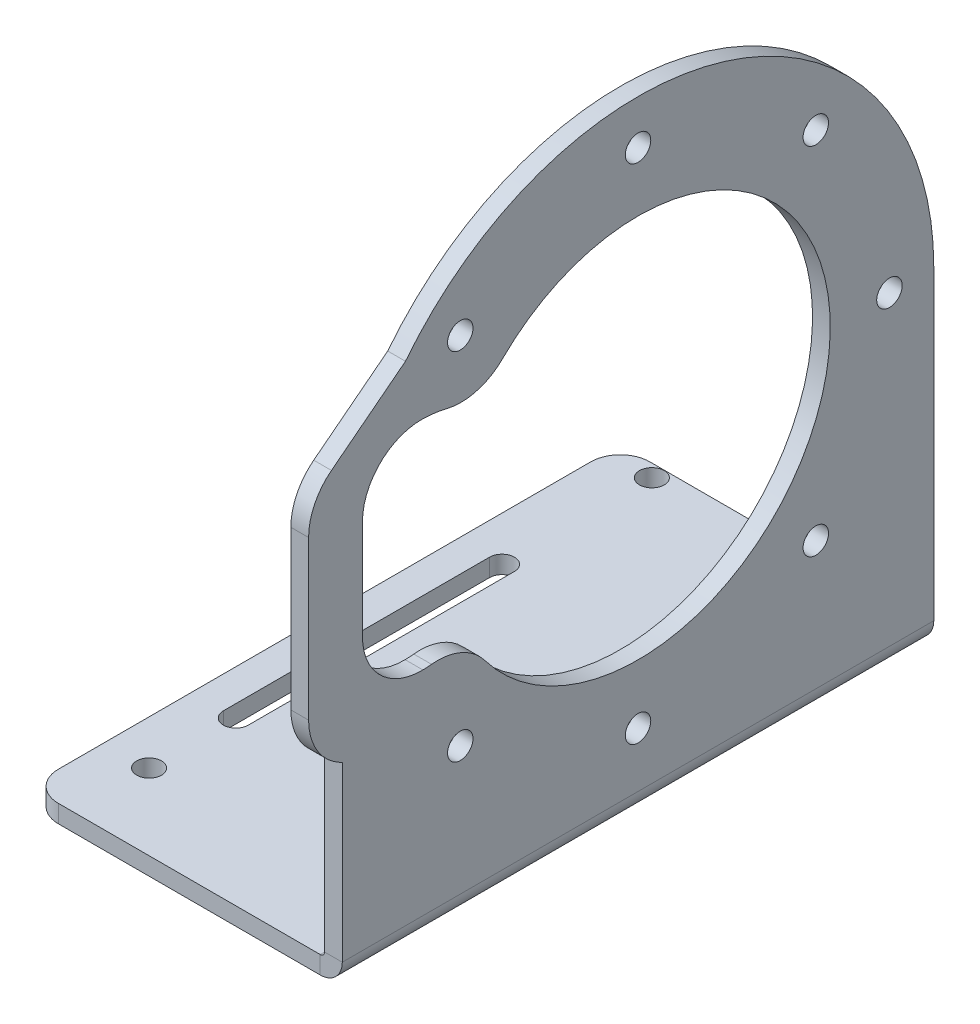
from build123d import *

# Parameters (mm, degrees)
SKETCH_1_R                       = 2.15
SM_BASE_FLANGE_1_DEPTH           = 3
SM_EDGE_FLANGE_1_STRIP_W         = 13.4732
SM_EDGE_FLANGE_1_STRIP_H         = 3
SM_EDGE_FLANGE_1_STRIP_CUT_DEPTH = 100
SM_EDGE_FLANGE_1_DEPTH           = 100
SKETCH_9_R                       = 2.1
CUT_EXTRUDE_1_DEPTH              = 10
FILLET_1_R                       = 5
SKETCH_10_R                      = 2.1
CUT_EXTRUDE_2_DEPTH              = 10


# Sheet-metal steps are written as plain solids
with BuildPart() as part:
    # Sketch 1 → 基体-法兰1 (new body)
    with BuildSketch(Plane(origin=(0, 0, 0), x_dir=(0, 0, -1), z_dir=(1, 0, 0))):
        with BuildLine():
            Line((-50, -22.510788707), (-50, -55.5))
            Line((-50, -55.5), (50, -55.5))
            Line((50, -55.5), (50, 0))
            ThreePointArc((50, 0), (16.339860062, 47.254724348), (-39.320358927, 30.885423324))
            Line((-39.320358927, 30.885423324), (-51.83191014, 21.160585638))
            ThreePointArc((-51.83191014, 21.160585638), (-54.677464079, 17.660055501), (-55.695008503, 13.265116159))
            Line((-55.695008503, 13.265116159), (-55.695008503, -13.471087591))
            ThreePointArc((-55.695008503, -13.471087591), (-54.312022765, -18.545244191), (-50.545595463, -22.215903549))
            ThreePointArc((-50.545595463, -22.215903549), (-50.273602999, -22.364836031), (-50, -22.510788707))
        make_face()
        with Locations((0, 42.5)):
            Circle(SKETCH_1_R, mode=Mode.SUBTRACT)
        with Locations((30.0520382, 30.0520382)):
            Circle(SKETCH_1_R, mode=Mode.SUBTRACT)
        with Locations((42.5, 0)):
            Circle(SKETCH_1_R, mode=Mode.SUBTRACT)
        with Locations((30.0520382, -30.0520382)):
            Circle(SKETCH_1_R, mode=Mode.SUBTRACT)
        with Locations((0, -42.5)):
            Circle(SKETCH_1_R, mode=Mode.SUBTRACT)
        with Locations((-30.0520382, -30.0520382)):
            Circle(SKETCH_1_R, mode=Mode.SUBTRACT)
        with Locations((-30.0520382, 30.0520382)):
            Circle(SKETCH_1_R, mode=Mode.SUBTRACT)
        with BuildLine():
            Line((-46.595603285, 10.997841176), (-46.595603285, -5.777394466))
            ThreePointArc((-46.595603285, -5.777394466), (-43.590659136, -12.923665777), (-36.381764555, -15.775107854))
            ThreePointArc((-36.381764555, -15.775107854), (-35.646197226, -15.744635296), (-34.912439019, -15.684745692))
            ThreePointArc((-34.912439019, -15.684745692), (-29.904748182, -16.465924493), (-25.923223086, -19.601951556))
            ThreePointArc((-25.923223086, -19.601951556), (32.418442092, -2.301002457), (-22.894661052, 23.066956784))
            ThreePointArc((-22.894661052, 23.066956784), (-27.279217704, 20.524739091), (-32.347042381, 20.45870218))
            ThreePointArc((-32.347042381, 20.45870218), (-34.349504558, 20.839101356), (-36.381764555, 20.995554565))
            ThreePointArc((-36.381764555, 20.995554565), (-43.590659136, 18.144112487), (-46.595603285, 10.997841176))
        make_face(mode=Mode.SUBTRACT)
    extrude(amount=-SM_BASE_FLANGE_1_DEPTH)

    # 边线-法兰1 strip (across the edge) → 边线-法兰1 strip cut (cut)
    with BuildSketch(Plane(origin=(-3, -55.5, -50), x_dir=(0, 1, 0), z_dir=(0, 0, 1))):
        with Locations((-3, -1.5)):
            Rectangle(SM_EDGE_FLANGE_1_STRIP_W, SM_EDGE_FLANGE_1_STRIP_H)
    extrude(amount=SM_EDGE_FLANGE_1_STRIP_CUT_DEPTH, mode=Mode.SUBTRACT)

    # 边线-法兰1 section (across the edge) → 边线-法兰1 (add)
    with BuildSketch(Plane(origin=(-3, -55.5, -50), x_dir=(0, 1, 0), z_dir=(0, 0, 1))):
        with BuildLine():
            Line((0, 0.7366), (0, 50))
            Line((0, 50), (3, 50))
            Line((3, 50), (3, 0.7366))
            ThreePointArc((3, 0.7366), (3.215745145, 0.215745145), (3.7366, 0))
            Line((3.7366, 0), (3.7366, -3))
            ThreePointArc((3.7366, -3), (1.094424801, -1.905575199), (0, 0.7366))
        make_face()
    extrude(amount=SM_EDGE_FLANGE_1_DEPTH)

    # 草图9 → 切除-拉伸1 (cut)
    with BuildSketch(Plane(origin=(0, -52.5, 0), x_dir=(1, 0, 0), z_dir=(0, 1, 0))):
        with Locations(Location((-45.5, 47.839820537, 0), (0, 0, 180))):
            Circle(SKETCH_9_R)
        with Locations(Location((-10.5, 47.839820537, 0), (0, 0, 180))):
            Circle(SKETCH_9_R)
        with Locations(Location((-45.5, -37.160179463, 0), (0, 0, 180))):
            Circle(SKETCH_9_R)
        with Locations(Location((-10.5, -37.160179463, 0), (0, 0, 180))):
            Circle(SKETCH_9_R)
    extrude(amount=-CUT_EXTRUDE_1_DEPTH, mode=Mode.SUBTRACT)

    # 圆角1
    fillet_1_edges = [part.edges().sort_by_distance(p)[0] for p in [
        (-53, -54, -50),
        (-53, -54, 50),
    ]]
    fillet(fillet_1_edges, radius=FILLET_1_R)

    # 草图10 → 切除-拉伸2 (cut)
    with BuildSketch(Plane(origin=(0, -52.5, 0), x_dir=(1, 0, 0), z_dir=(0, 1, 0))):
        with Locations(Location((-28, 0, 0), (0, 0, 180))):
            Circle(SKETCH_10_R)
        with BuildLine():
            Line((-43.4, 22.5), (-43.4, -22.5))
            ThreePointArc((-43.4, -22.5), (-45.5, -24.6), (-47.6, -22.5))
            Line((-47.6, -22.5), (-47.6, 22.5))
            ThreePointArc((-47.6, 22.5), (-45.5, 24.6), (-43.4, 22.5))
        make_face()
        with BuildLine():
            Line((-8.4, 22.5), (-8.4, -22.5))
            ThreePointArc((-8.4, -22.5), (-10.5, -24.6), (-12.6, -22.5))
            Line((-12.6, -22.5), (-12.6, 22.5))
            ThreePointArc((-12.6, 22.5), (-10.5, 24.6), (-8.4, 22.5))
        make_face()
    extrude(amount=-CUT_EXTRUDE_2_DEPTH, mode=Mode.SUBTRACT)


solid = part.part
